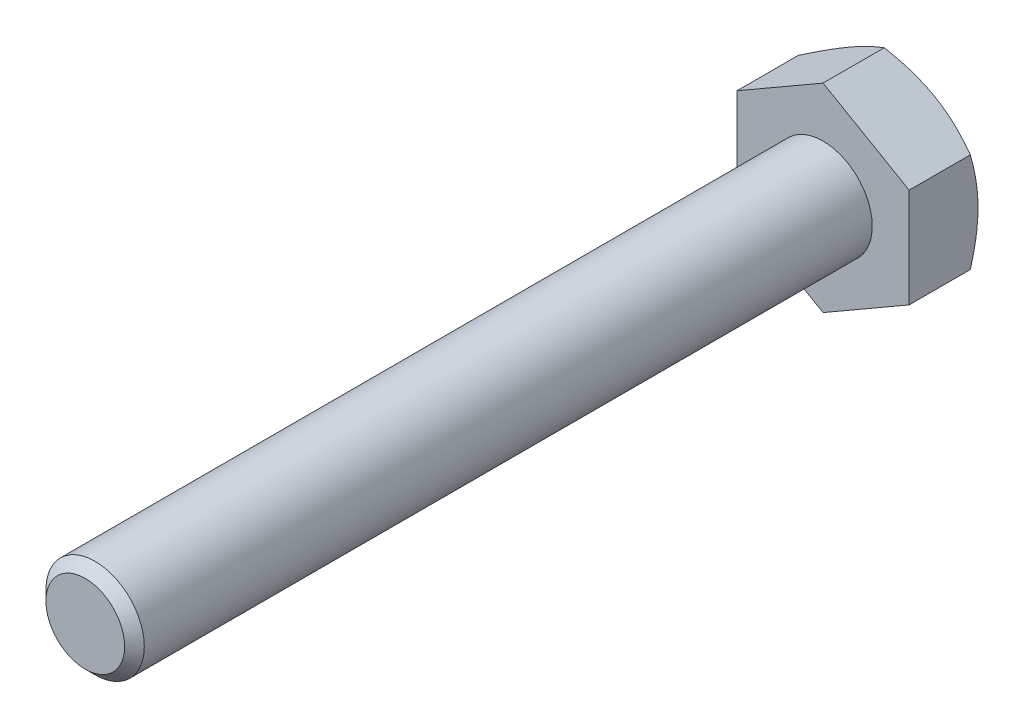
from build123d import *

# Parameters (mm, degrees)
ESQUISSE1_W        = 2
ESQUISSE1_H        = 30
BOSS_EXTRU_1_DEPTH = 2.8


with BuildPart() as part:
    # Esquisse1 → Base-Révolution (revolve)
    with BuildSketch(Plane(origin=(0, 0, 0), x_dir=(1, 0, 0), z_dir=(0, 1, 0))):
        with Locations((1, -15)):
            Rectangle(ESQUISSE1_W, ESQUISSE1_H)
    revolve(axis=Axis((0, 0, 0), (0, 0, 1)))

    # Chanfrein1: read off the stored shape, not the designer's step
    # Chanfrein1 outline → Chanfrein1 (revolve, cut)
    with BuildSketch(Plane.XZ):
        Polygon((2, 30), (1.6, 30), (2, 29.6), align=None)
    revolve(axis=Axis((0, 0, 0), (0, 0, 1)), mode=Mode.SUBTRACT)

    # Esquisse6 → Boss.-Extru.1 (add)
    with BuildSketch(Plane.XY):
        Polygon((3.5, -2.020725942), (3.5, 2.020725942), (0, 4.041451884), (-3.5, 2.020725942), (-3.5, -2.020725942), (0, -4.041451884), align=None)
    extrude(amount=-BOSS_EXTRU_1_DEPTH)

    # Esquisse7 → Enlèvement de matière-Révolution1 (revolve, cut)
    with BuildSketch(Plane(origin=(0, 0, 0), x_dir=(1, 0, 0), z_dir=(0, 1, 0))):
        Polygon((-3.5, 2.8), (-8.349742261, 2.8), (-8.349742261, 0), align=None)
    revolve(axis=Axis((0, 0, -6.239446496), (0, 0, 1)), mode=Mode.SUBTRACT)


solid = part.part
